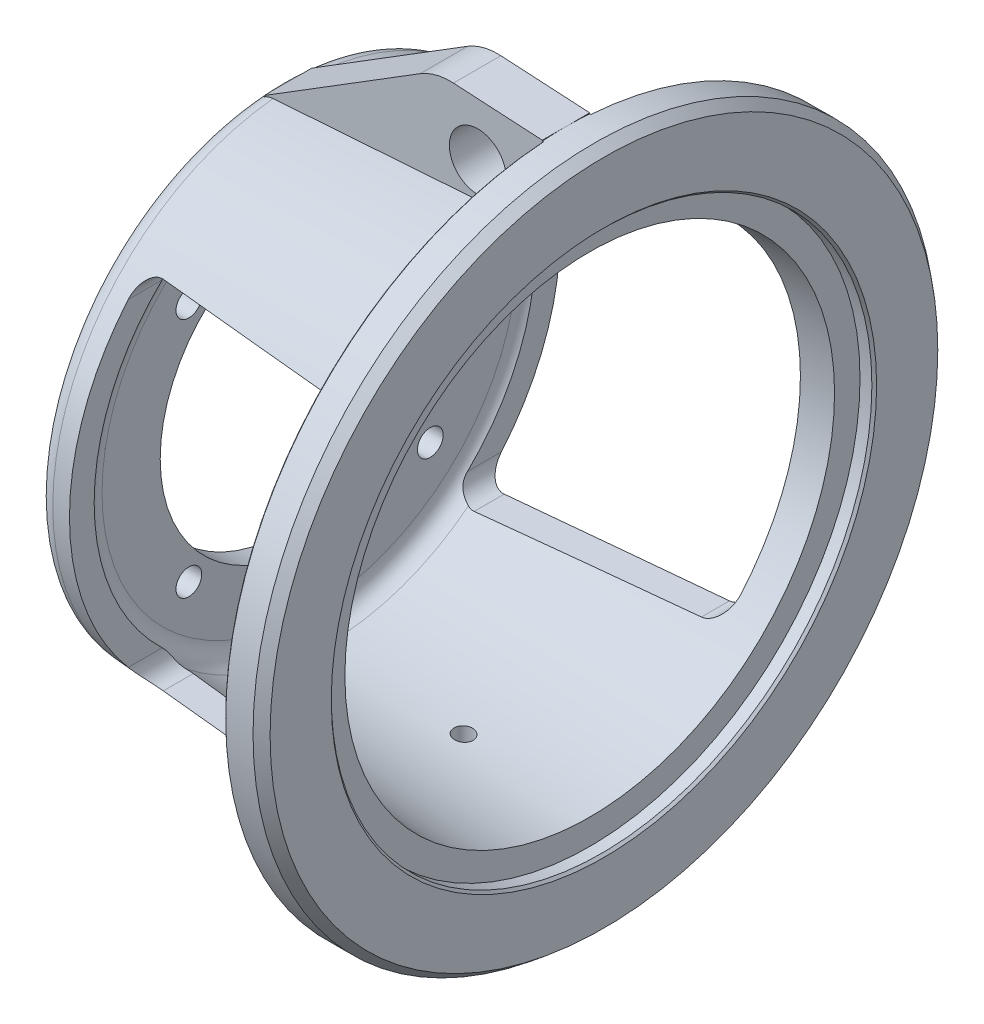
from build123d import *

# Parameters (mm, degrees)
SKETCH3_R               = 133.35
CUT_EXTRUDE1_DEPTH      = 4.7752
CUT_EXTRUDE2_REACH      = 388.957
SKETCH4_R               = 100.0125
SKETCH5_R               = 180.97627
CUT_EXTRUDE3_DEPTH      = 9.525
CUT_EXTRUDE4_REACH      = 388.957
SKETCH6_R               = 8.636
CIRPATTERN1_COUNT       = 4
BOSS_EXTRUDE1_DEPTH     = 15.875
CUT_EXTRUDE6_REACH      = 403.103
SKETCH9_R               = 19.05
CUT_EXTRUDE7_REACH      = 393.629
SKETCH10_R              = 6.35
CUT_EXTRUDE8_DEPTH      = 392.629265229
CUT_EXTRUDE8_DEPTH_BACK = 392.629265229
CHAMFER1_SIZE           = 1.5875
CHAMFER2_SIZE           = 0.79375
CHAMFER4_SIZE           = 5.08
CHAMFER4_SIZE2          = 6.35


with BuildPart() as part:
    # Sketch2 → Revolve1 (revolve)
    with BuildSketch(Plane.XY):
        with BuildLine():
            Line((0, 0), (0, 150.729136562))
            ThreePointArc((0, 150.729136562), (3.411807989, 159.390515734), (11.814092783, 163.3982))
            Line((11.814092783, 163.3982), (180.209907217, 175.173582448))
            ThreePointArc((180.209907217, 175.173582448), (188.612192011, 179.181266713), (192.024, 187.842645886))
            Line((192.024, 187.842645886), (192.024, 228.6))
            Line((192.024, 228.6), (217.424, 228.6))
            Line((217.424, 228.6), (217.424, 180.975))
            Line((217.424, 180.975), (207.899, 180.975))
            Line((207.899, 180.975), (207.899, 163.926903472))
            Line((207.899, 163.926903472), (32.159492783, 151.638))
            ThreePointArc((32.159492783, 151.638), (23.757207989, 147.630315734), (20.3454, 138.968936562))
            Line((20.3454, 138.968936562), (20.3454, 0))
            Line((20.3454, 0), (0, 0))
        make_face()
    revolve(axis=Axis((0, 0, 0), (1, 0, 0)))

    # Sketch3 → Cut-Extrude1 (cut)
    with BuildSketch(Plane.ZY):
        Circle(SKETCH3_R)
    extrude(amount=-CUT_EXTRUDE1_DEPTH, mode=Mode.SUBTRACT)

    # Sketch4 → Cut-Extrude2 (cut, up to next)
    with BuildSketch(Plane.ZY.offset(-4.7752), mode=Mode.PRIVATE) as cut_extrude2_sk1:
        Circle(SKETCH4_R)
    cut_extrude2_tool1 = extrude(cut_extrude2_sk1.sketch, amount=-CUT_EXTRUDE2_REACH, mode=Mode.PRIVATE) & part.part
    add(cut_extrude2_tool1.solids().sort_by_distance((4.7752, 0, 0))[0], mode=Mode.SUBTRACT)

    # Sketch5 → Cut-Extrude3 (cut)
    with BuildSketch(Plane(origin=(217.424, 0, 0), x_dir=(0, 0, -1), z_dir=(1, 0, 0))):
        Circle(SKETCH5_R)
    extrude(amount=-CUT_EXTRUDE3_DEPTH, mode=Mode.SUBTRACT)

    # Sketch6 → Cut-Extrude4 (cut, up to next)
    with BuildSketch(Plane.ZY.offset(-4.7752), mode=Mode.PRIVATE) as cut_extrude4_sk1:
        with Locations((80.82230509, 80.82230509)):
            Circle(SKETCH6_R)
    cut_extrude4_tool1 = extrude(cut_extrude4_sk1.sketch, amount=-CUT_EXTRUDE4_REACH, mode=Mode.PRIVATE) & part.part
    cut_extrude4 = cut_extrude4_tool1.solids().sort_by_distance((4.7752, 80.822305, 80.822305))[0]
    add(cut_extrude4, mode=Mode.SUBTRACT)

    # CirPattern1: Cut-Extrude4 ×4 about axis
    cirpattern1_axis = Axis((4.7752, 0, 0), (-1, 0, 0))
    for i in range(1, CIRPATTERN1_COUNT):
        add(cut_extrude4.rotate(cirpattern1_axis, i * 360 / CIRPATTERN1_COUNT), mode=Mode.SUBTRACT)

    # Sketch8 → Boss-Extrude1 (add, symmetric)
    with BuildSketch(Plane.XY):
        with BuildLine():
            Line((192.024, 173.460953796), (192.024, 228.6))
            Line((192.024, 228.6), (132.538836408, 231.9782))
            ThreePointArc((132.538836408, 231.9782), (120.967207489, 230.858806132), (110.271848346, 226.301950716))
            Line((110.271848346, 226.301950716), (5.987343994, 161.510149934))
            Line((5.987343994, 161.510149934), (5.448843156, 158.54562766))
            Line((5.448843156, 158.54562766), (192.024, 173.460953796))
        make_face()
    extrude(amount=BOSS_EXTRUDE1_DEPTH, both=True)

    # Sketch9 → Cut-Extrude6 (cut, up to next)
    with BuildSketch(Plane.XY.offset(15.875), mode=Mode.PRIVATE) as cut_extrude6_sk1:
        with Locations((148.844, 194.564)):
            Circle(SKETCH9_R)
    cut_extrude6_tool1 = extrude(cut_extrude6_sk1.sketch, amount=-CUT_EXTRUDE6_REACH, mode=Mode.PRIVATE) & part.part
    add(cut_extrude6_tool1.solids().sort_by_distance((148.844, 194.564, 15.875))[0], mode=Mode.SUBTRACT)

    # Sketch10 → Cut-Extrude7 (cut, up to next)
    with BuildSketch(Plane(origin=(0, 0, 0), x_dir=(1, 0, 0), z_dir=(0, 1, 0)), mode=Mode.PRIVATE) as cut_extrude7_sk1:
        with Locations((123.444, 0)):
            Circle(SKETCH10_R)
    cut_extrude7_tool1 = extrude(cut_extrude7_sk1.sketch, amount=-CUT_EXTRUDE7_REACH, mode=Mode.PRIVATE) & part.part
    add(cut_extrude7_tool1.solids().sort_by_distance((123.444, 0, 0))[0], mode=Mode.SUBTRACT)

    # Sketch11 → Cut-Extrude8 (cut, two sides: drawn at the far end of the back side and taken through both)
    with BuildSketch(Plane.XY.offset(-CUT_EXTRUDE8_DEPTH_BACK)):
        with BuildLine():
            Line((36.5252, -119.3419), (173.8376, -119.3419))
            ThreePointArc((173.8376, -119.3419), (182.817856121, -115.622156121), (186.5376, -106.6419))
            Line((186.5376, -106.6419), (186.5376, 106.6419))
            ThreePointArc((186.5376, 106.6419), (182.817856121, 115.622156121), (173.8376, 119.3419))
            Line((173.8376, 119.3419), (36.5252, 119.3419))
            ThreePointArc((36.5252, 119.3419), (27.544943879, 115.622156121), (23.8252, 106.6419))
            Line((23.8252, 106.6419), (23.8252, -106.6419))
            ThreePointArc((23.8252, -106.6419), (27.544943879, -115.622156121), (36.5252, -119.3419))
        make_face()
    extrude(amount=CUT_EXTRUDE8_DEPTH + CUT_EXTRUDE8_DEPTH_BACK, mode=Mode.SUBTRACT)

    # Chamfer1
    chamfer1_edges = [part.edges().sort_by_distance(p)[0] for p in [
        (217.424, 0, 180.97627),
    ]]
    chamfer(chamfer1_edges, length=CHAMFER1_SIZE)

    # Chamfer2
    chamfer2_edges = [part.edges().sort_by_distance(p)[0] for p in [
        (192.024, -228.6, 0),
    ]]
    chamfer(chamfer2_edges, length=CHAMFER2_SIZE)

    # Chamfer4
    chamfer4_edges = [part.edges().sort_by_distance(p)[0] for p in [
        (217.424, -228.6, 0),
    ]]
    chamfer4_side = [part.faces().sort_by_distance(p)[0] for p in [
        (217.424, 0, 189.029554407),
    ]]
    chamfer(chamfer4_edges, length=CHAMFER4_SIZE, length2=CHAMFER4_SIZE2, reference=chamfer4_side[0])


solid = part.part
